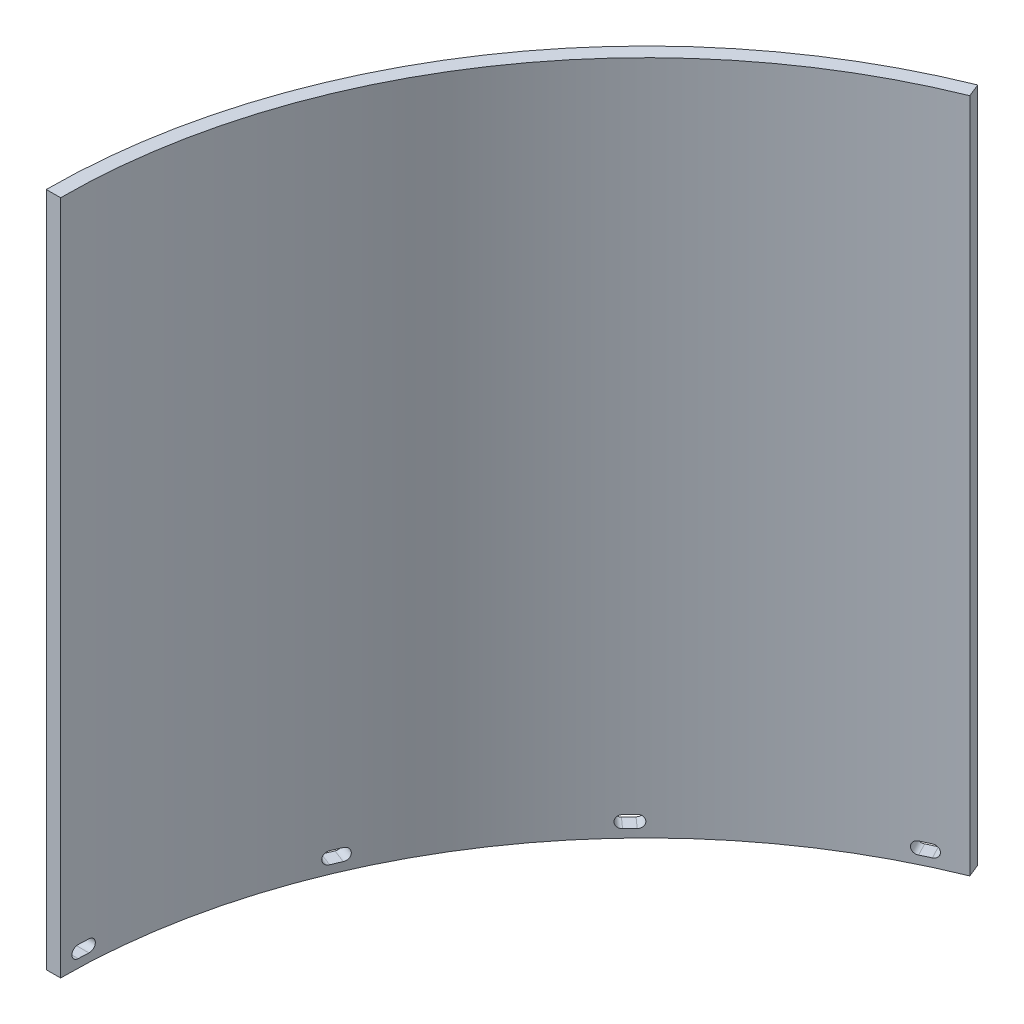
from build123d import *

# Parameters (mm, degrees)
BOSS_EXTRUDE1_DEPTH        = 150
M2_5_START                 = -133.151532693
M2_5_CLEARANCE_SLOT1_DEPTH = 3.368059081
CIRPATTERN1_COUNT          = 4
CIRPATTERN1_ANGLE          = 62.5


# Read off the part's stored shape, not the designer's step: M2.5 Clearance Slot1
with BuildPart() as part:
    # Sketch1 → Boss-Extrude1 (new body)
    with BuildSketch(Plane(origin=(0, 0, 0), x_dir=(1, 0, 0), z_dir=(0, 1, 0))):
        with BuildLine():
            Line((-130, 0), (-133.175, 0))
            ThreePointArc((-133.175, 0), (-110.407078725, 74.47051492), (-49.888233078, 123.477709832))
            Line((-49.888233078, 123.477709832), (-48.698857144, 120.533901094))
            ThreePointArc((-48.698857144, 120.533901094), (-107.774884432, 72.695077451), (-130, 0))
        make_face()
    extrude(amount=BOSS_EXTRUDE1_DEPTH)

    # M2.5 Clearance Slot1 outline → M2.5 Clearance Slot1 (cut)
    with BuildSketch(Plane.YZ.offset(M2_5_START)):
        with BuildLine():
            ThreePointArc((1.825, -6.15), (3.175, -7.5), (4.525, -6.15))
            Line((4.525, -6.15), (4.525, -3.85))
            ThreePointArc((4.525, -3.85), (3.175, -2.5), (1.825, -3.85))
            Line((1.825, -3.85), (1.825, -6.15))
        make_face()
    m2_5_clearance_slot1 = extrude(amount=M2_5_CLEARANCE_SLOT1_DEPTH, mode=Mode.SUBTRACT)

    # CirPattern1: M2.5 Clearance Slot1 ×4 about axis
    cirpattern1_axis = Axis((0, 150, 0), (0, -1, 0))
    for i in range(1, CIRPATTERN1_COUNT):
        add(m2_5_clearance_slot1.rotate(cirpattern1_axis, i * CIRPATTERN1_ANGLE / (CIRPATTERN1_COUNT - 1)), mode=Mode.SUBTRACT)


solid = part.part
